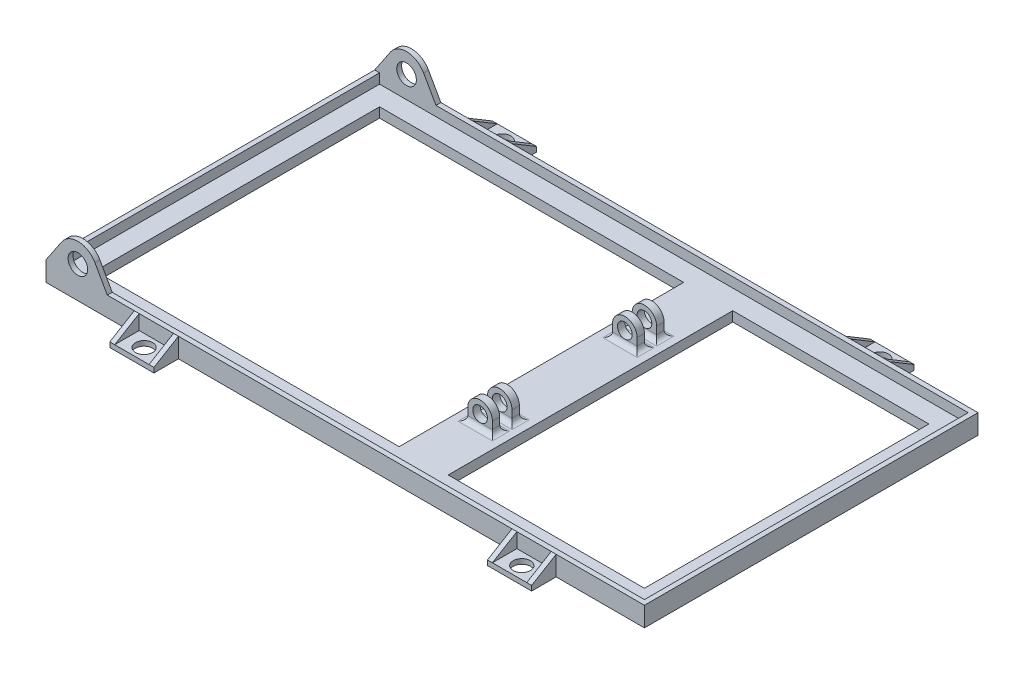
from build123d import *

# Parameters (mm, degrees)
SKETCH_2_W               = 120
SKETCH_2_H               = 66
SKETCH_2_W_2             = 112
SKETCH_2_H_2             = 58
EXTRUDE_1_DEPTH          = 2
SKETCH_2_2_W             = 122
SKETCH_2_2_H             = 68
SKETCH_2_2_W_2           = 120
SKETCH_2_2_H_2           = 66
EXTRUDE_1_2_DEPTH        = 4
SKETCH_3_R               = 2
EXTRUDE_2_DEPTH          = 1
SKETCH_4_W               = 10
SKETCH_4_H               = 2
EXTRUDE_3_DEPTH          = 68
EXTRUDE_START            = 12
SKETCH_5_R               = 1.5
EXTRUDE_4_DEPTH          = 1.5
EXTRUDE_START_2          = 16
SKETCH_5_3_R             = 1.5
EXTRUDE_6_DEPTH          = 1.5
FILLET_2_R               = 1
FILLET_2_OF_MIRROR_3_R   = 1
SKETCH_7_W               = 9
SKETCH_7_H               = 5
EXTRUDE_7_DEPTH          = 1
EXTRUDE_8_DEPTH          = 1
EXTRUDE_9_DEPTH          = 1
CUT_EXTRUDE_1_REACH      = 75.022
SKETCH_10_R              = 1.75
MIRROR_6_COPY_1_SKETCH_W = 9
MIRROR_6_COPY_1_SKETCH_H = 5
MIRROR_6_COPY_1_DEPTH    = 1
MIRROR_6_COPY_2_DEPTH    = 1
MIRROR_6_COPY_3_DEPTH    = 1
MIRROR_6_COPY_4_REACH    = 75.022
MIRROR_6_COPY_4_SKETCH_R = 1.75


with BuildPart() as part:
    # 草圖2 → Extrude 1 (new body)
    with BuildSketch(Plane(origin=(0, 0, 0), x_dir=(1, 0, 0), z_dir=(0, 1, 0))):
        Rectangle(SKETCH_2_W, SKETCH_2_H)
        Rectangle(SKETCH_2_W_2, SKETCH_2_H_2, mode=Mode.SUBTRACT)
    extrude(amount=EXTRUDE_1_DEPTH)

    # 草圖2<2> → Extrude 1 2 (add)
    with BuildSketch(Plane(origin=(0, 0, 0), x_dir=(1, 0, 0), z_dir=(0, 1, 0))):
        Rectangle(SKETCH_2_2_W, SKETCH_2_2_H)
        Rectangle(SKETCH_2_2_W_2, SKETCH_2_2_H_2, mode=Mode.SUBTRACT)
    extrude(amount=EXTRUDE_1_2_DEPTH)

    # 草圖3 → 填料-伸長2 (add)
    with BuildSketch(Plane.XY.offset(34)):
        with BuildLine():
            Line((-61, 4), (-57.819768479, 8.731398047))
            ThreePointArc((-57.819768479, 8.731398047), (-54.342718511, 10.496906621), (-51.015153756, 8.463630987))
            Line((-51.015153756, 8.463630987), (-48.5, 4))
            Line((-48.5, 4), (-61, 4))
        make_face()
        with Locations((-54.5, 6.5)):
            Circle(SKETCH_3_R, mode=Mode.SUBTRACT)
    extrude_2 = extrude(amount=-EXTRUDE_2_DEPTH)

    # 鏡射1: 填料-伸長2 across plane
    add(extrude_2.mirror(Plane.XY))

    # 草圖4 → 填料-伸長3 (add)
    with BuildSketch(Plane.XY.offset(34)):
        with Locations((11, 1)):
            Rectangle(SKETCH_4_W, SKETCH_4_H)
    extrude(amount=-EXTRUDE_3_DEPTH)

    # 草圖5 → 填料-伸長4 (add)
    with BuildSketch(Plane.XY.offset(EXTRUDE_START)):
        with BuildLine():
            Line((8.5, 4.5), (8.5, 2))
            Line((8.5, 2), (13.5, 2))
            Line((13.5, 2), (13.5, 4.5))
            ThreePointArc((13.5, 4.5), (11, 7), (8.5, 4.5))
        make_face()
        with Locations((11, 4.5)):
            Circle(SKETCH_5_R, mode=Mode.SUBTRACT)
    extrude_4 = extrude(amount=EXTRUDE_4_DEPTH)

    # 草圖5<3> → 填料-伸長6 (add)
    with BuildSketch(Plane.XY.offset(EXTRUDE_START_2)):
        with BuildLine():
            Line((8.5, 4.5), (8.5, 2))
            Line((8.5, 2), (13.5, 2))
            Line((13.5, 2), (13.5, 4.5))
            ThreePointArc((13.5, 4.5), (11, 7), (8.5, 4.5))
        make_face()
        with Locations((11, 4.5)):
            Circle(SKETCH_5_3_R, mode=Mode.SUBTRACT)
    extrude_6 = extrude(amount=EXTRUDE_6_DEPTH)

    # 圓角2
    fillet_2_edges = [part.edges().sort_by_distance(p)[0] for p in [
        (11, 2, 13.5),
        (11, 2, 12),
        (8.5, 2, 12.75),
        (13.5, 2, 12.75),
        (11, 2, 17.5),
        (11, 2, 16),
        (8.5, 2, 16.75),
        (13.5, 2, 16.75),
    ]]
    fillet(fillet_2_edges, radius=FILLET_2_R - 0.0001)  # a hair under: the kernel refuses the full size

    # 鏡射3: 填料-伸長4, 填料-伸長6 across plane
    add(extrude_4.mirror(Plane.XY))
    add(extrude_6.mirror(Plane.XY))

    # 圓角2 of 鏡射3
    fillet_2_of_mirror_3_edges = [part.edges().sort_by_distance(p)[0] for p in [
        (11, 2, -13.5),
        (11, 2, -12),
        (8.5, 2, -12.75),
        (13.5, 2, -12.75),
        (11, 2, -17.5),
        (11, 2, -16),
        (8.5, 2, -16.75),
        (13.5, 2, -16.75),
    ]]
    fillet(fillet_2_of_mirror_3_edges, radius=FILLET_2_OF_MIRROR_3_R - 0.0001)  # a hair under: the kernel refuses the full size

    # 草圖7 → 填料-伸長7 (add)
    with BuildSketch(Plane.XZ):
        with Locations((38.5, 36.5)):
            Rectangle(SKETCH_7_W, SKETCH_7_H)
    extrude_7 = extrude(amount=-EXTRUDE_7_DEPTH)

    # 草圖8 → 填料-伸長8 (add)
    with BuildSketch(Plane(origin=(43, 0, 0), x_dir=(0, 0, -1), z_dir=(1, 0, 0))):
        Polygon((-39, 1), (-34, 4), (-34, 1), align=None)
    extrude_8 = extrude(amount=-EXTRUDE_8_DEPTH)

    # 草圖9 → 填料-伸長9 (add)
    with BuildSketch(Plane.ZY.offset(-34)):
        Polygon((39, 1), (34, 4), (34, 1), align=None)
    extrude_9 = extrude(amount=-EXTRUDE_9_DEPTH)

    # 草圖10 → 除料-伸長1 (cut, up to next)
    with BuildSketch(Plane(origin=(0, 1, 0), x_dir=(1, 0, 0), z_dir=(0, 1, 0)), mode=Mode.PRIVATE) as cut_extrude_1_sk1:
        with Locations(Location((38.5, -36.5, 0), (0, 0, 270))):
            Circle(SKETCH_10_R)
    cut_extrude_1_tool1 = extrude(cut_extrude_1_sk1.sketch, amount=-CUT_EXTRUDE_1_REACH, mode=Mode.PRIVATE) & part.part
    cut_extrude_1 = cut_extrude_1_tool1.solids().sort_by_distance((38.5, 1, 36.5))[0]
    add(cut_extrude_1, mode=Mode.SUBTRACT)

    # 鏡射5: 填料-伸長7, 填料-伸長8, 填料-伸長9, 除料-伸長1 across plane
    add(extrude_7.mirror(Plane.XY))
    add(extrude_8.mirror(Plane.XY))
    add(extrude_9.mirror(Plane.XY))
    add(cut_extrude_1.mirror(Plane.XY), mode=Mode.SUBTRACT)

    # 鏡射6: 填料-伸長7, 填料-伸長8, 填料-伸長9, 除料-伸長1 across plane
    add(extrude_7.mirror(Plane(origin=(0, 0, 0), x_dir=(0, 0, 1), z_dir=(1, 0, 0))))
    add(extrude_8.mirror(Plane(origin=(0, 0, 0), x_dir=(0, 0, 1), z_dir=(1, 0, 0))))
    add(extrude_9.mirror(Plane(origin=(0, 0, 0), x_dir=(0, 0, 1), z_dir=(1, 0, 0))))
    add(cut_extrude_1.mirror(Plane(origin=(0, 0, 0), x_dir=(0, 0, 1), z_dir=(1, 0, 0))), mode=Mode.SUBTRACT)

    # 鏡射6 copy 1 sketch → 鏡射6 copy 1 (add)
    with BuildSketch(Plane(origin=(0, 0, 0), x_dir=(-1, 0, 0), z_dir=(0, -1, 0))):
        with Locations((38.5, 36.5)):
            Rectangle(MIRROR_6_COPY_1_SKETCH_W, MIRROR_6_COPY_1_SKETCH_H)
    extrude(amount=-MIRROR_6_COPY_1_DEPTH)

    # 鏡射6 copy 2 sketch → 鏡射6 copy 2 (add)
    with BuildSketch(Plane.ZY.offset(43)):
        Polygon((-39, 1), (-34, 4), (-34, 1), align=None)
    extrude(amount=-MIRROR_6_COPY_2_DEPTH)

    # 鏡射6 copy 3 sketch → 鏡射6 copy 3 (add)
    with BuildSketch(Plane(origin=(-34, 0, 0), x_dir=(0, 0, -1), z_dir=(1, 0, 0))):
        Polygon((39, 1), (34, 4), (34, 1), align=None)
    extrude(amount=-MIRROR_6_COPY_3_DEPTH)

    # 鏡射6 copy 4 sketch → 鏡射6 copy 4 (cut, up to next)
    with BuildSketch(Plane(origin=(0, 1, 0), x_dir=(-1, 0, 0), z_dir=(0, 1, 0)), mode=Mode.PRIVATE) as mirror_6_copy_4_sk1:
        with Locations(Location((38.5, -36.5, 0), (0, 0, 270))):
            Circle(MIRROR_6_COPY_4_SKETCH_R)
    mirror_6_copy_4_tool1 = extrude(mirror_6_copy_4_sk1.sketch, amount=-MIRROR_6_COPY_4_REACH, mode=Mode.PRIVATE) & part.part
    add(mirror_6_copy_4_tool1.solids().sort_by_distance((-38.5, 1, -36.5))[0], mode=Mode.SUBTRACT)


solid = part.part
